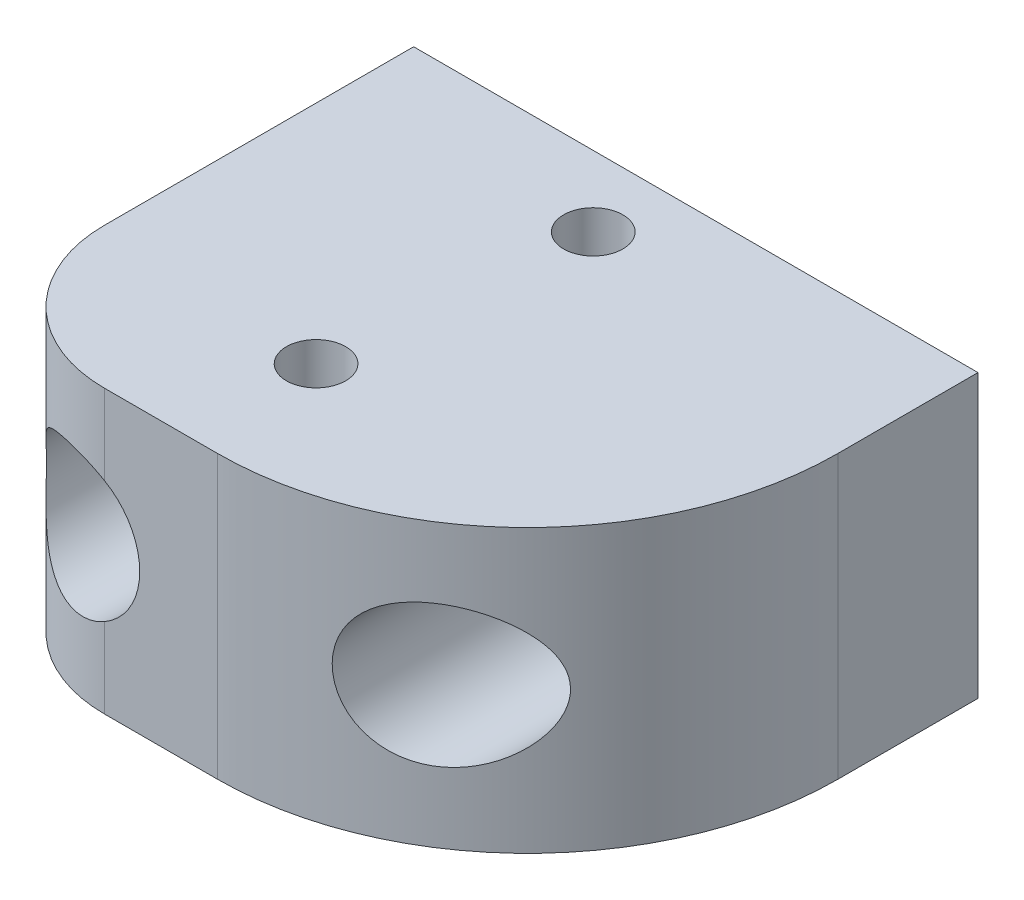
from build123d import *

# Parameters (mm, degrees)
SKETCH2_W                      = 40
SKETCH2_H                      = 31.916671008
BOSS_EXTRUDE1_DEPTH            = 20
CBORE_FOR_M5_SHCS1_D           = 5.5
CBORE_FOR_M5_SHCS1_CBORE_D     = 10
CBORE_FOR_M5_SHCS1_CBORE_DEPTH = 25
M5X0_8_TAPPED_HOLE1_D          = 4.2
FILLET1_R                      = 22
FILLET2_START                  = -21
FILLET2_DEPTH                  = 22


with BuildPart() as part:
    # Sketch2 → Boss-Extrude1 (new body)
    with BuildSketch(Plane(origin=(0, 0, 0), x_dir=(1, 0, 0), z_dir=(0, 1, 0))):
        with Locations((2.27, -10.958335504)):
            Rectangle(SKETCH2_W, SKETCH2_H)
    extrude(amount=-BOSS_EXTRUDE1_DEPTH)

    # CBORE for M5 SHCS1 (through all)
    with Locations(Plane.XY.offset(26.916671008)):
        with Locations((-10.23, -10), (12.27, -10)):
            CounterBoreHole(CBORE_FOR_M5_SHCS1_D / 2, CBORE_FOR_M5_SHCS1_CBORE_D / 2, CBORE_FOR_M5_SHCS1_CBORE_DEPTH)

    # M5x0.8 Tapped Hole1 (through all)
    with Locations(Plane(origin=(0, 0, 0), x_dir=(1, 0, 0), z_dir=(0, 1, 0))):
        with Locations((-1.73, -17.916671008), (0, 0)):
            Hole(M5X0_8_TAPPED_HOLE1_D / 2)

    # Fillet1
    # the kernel refuses this fillet: 22 mm, written as the material it takes off along each edge
    with BuildSketch(Plane(origin=(22.27, 55, 26.916671008), x_dir=(0, 0, -1), z_dir=(0, -1, 0))) as fillet1_piece_1:
        with BuildLine():
            CenterArc((FILLET1_R, -FILLET1_R), FILLET1_R, 90, 90)
            Line((0, -FILLET1_R), (0, 0))
            Line((0, 0), (FILLET1_R, 0))
        make_face()
    extrude(amount=130, mode=Mode.SUBTRACT)

    # Fillet2: read off the stored shape, not the designer's step
    # Fillet2 outline → Fillet2 (cut)
    with BuildSketch(Plane(origin=(0, 0, 0), x_dir=(1, 0, 0), z_dir=(0, 1, 0)).offset(FILLET2_START)):
        with BuildLine():
            ThreePointArc((-7.73, -26.916671008), (-14.801067812, -23.98773882), (-17.73, -16.916671008))
            Line((-17.73, -16.916671008), (-17.73, -26.916671008))
            Line((-17.73, -26.916671008), (-7.73, -26.916671008))
        make_face()
    extrude(amount=FILLET2_DEPTH, mode=Mode.SUBTRACT)


solid = part.part
